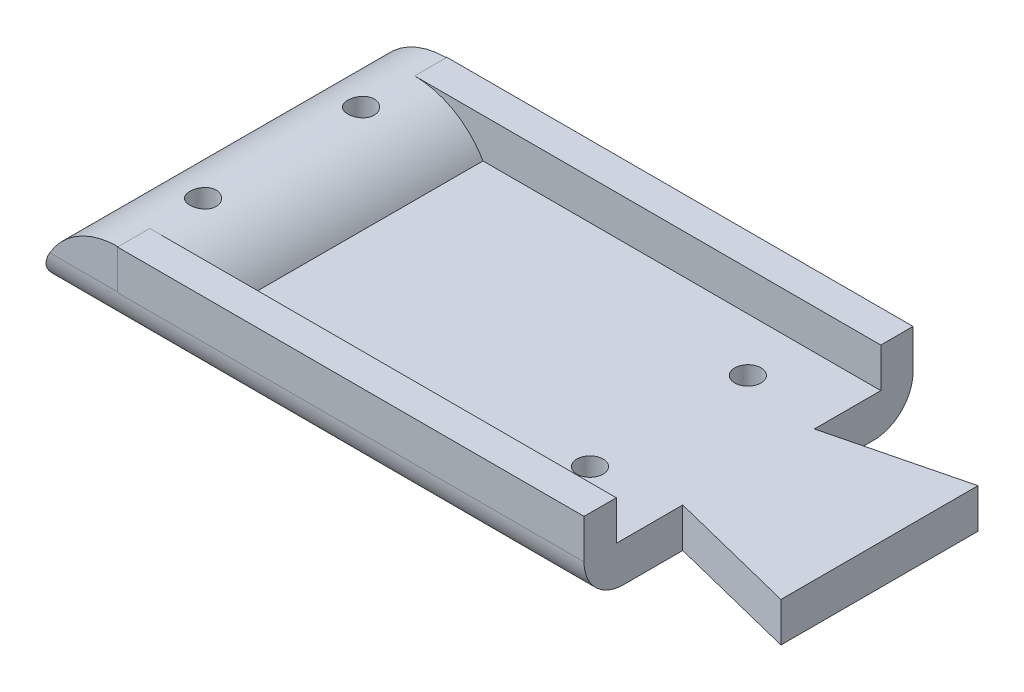
from build123d import *

# Parameters (mm, degrees)
CROQUIS1_R              = 0.999999899
CROQUIS1_R_2            = 0.999998866
CROQUIS1_R_3            = 1.000000014
CROQUIS1_R_4            = 0.999999985
SALIENTE_EXTRUIR1_DEPTH = 3
SALIENTE_EXTRUIR2_REACH = 38.281
CROQUIS3_W              = 35.45
CROQUIS3_H              = 2.45
SALIENTE_EXTRUIR3_DEPTH = 3
CROQUIS4_R              = 0.999999985
CROQUIS4_R_2            = 1.000000014
CORTAR_EXTRUIR1_DEPTH   = 17
CORTAR_EXTRUIR2_DEPTH   = 31
REDONDEO1_R             = 3


with BuildPart() as part:
    # Croquis1 → Saliente-Extruir1 (new body)
    with BuildSketch(Plane(origin=(0, 0, 0), x_dir=(1, 0, 0), z_dir=(0, 1, 0))):
        Polygon((25.246177886, -7.147133033), (25.246177886, 7.827867349), (15.296177123, 5.340367158), (15.296177123, 12.840367158), (-26.15382364, 12.790366967), (-26.15382364, -12.109632651), (15.296177123, -12.159632842), (15.296177123, -4.659632842), align=None)
        with Locations(Location((9.246177066, 6.34036702, 0), (0, 0, 270))):
            Circle(CROQUIS1_R, mode=Mode.SUBTRACT)
        with Locations(Location((9.246182607, -5.65963638, 0), (0, 0, 270))):
            Circle(CROQUIS1_R_2, mode=Mode.SUBTRACT)
        with Locations(Location((-20.153822905, -5.659632902, 0), (0, 0, 270))):
            Circle(CROQUIS1_R_3, mode=Mode.SUBTRACT)
        with Locations(Location((-20.15382331, 6.340367521, 0), (0, 0, 270))):
            Circle(CROQUIS1_R_4, mode=Mode.SUBTRACT)
    extrude(amount=SALIENTE_EXTRUIR1_DEPTH)

    # Saliente-Extruir2: up to this plane
    saliente_extruir2_end = Plane(origin=(15.296177123, 3, -12.840367158), z_dir=(0.0012062763193973866, 0, 0.999999272448456))
    # Croquis2 → Saliente-Extruir2 (add, up to the surface)
    with BuildSketch(Plane(origin=(-0.014645609, 0, 12.141163746), x_dir=(0.999999272448456, 0, 0.0012062763194219445), z_dir=(-0.0012062763194219447, 0, 0.999999272448456)), mode=Mode.PRIVATE) as saliente_extruir2_sk1:
        with BuildLine():
            Line((-25.335349472, 3), (-14.943044626, 3))
            ThreePointArc((-14.943044626, 3), (-20.139197049, 6), (-25.335349472, 3))
        make_face()
    saliente_extruir2_tool1 = split(extrude(saliente_extruir2_sk1.sketch, amount=-SALIENTE_EXTRUIR2_REACH, mode=Mode.PRIVATE), bisect_by=saliente_extruir2_end, keep=Keep.BOTH, mode=Mode.PRIVATE)
    add(saliente_extruir2_tool1.solids().sort_by_distance((-20.153828, 4.230121, 12.11687))[0])

    # Croquis3 → Saliente-Extruir3 (add)
    with BuildSketch(Plane(origin=(0, 3, 0), x_dir=(1, 0, 0), z_dir=(0, 1, 0))):
        with Locations((-2.428822877, -10.934632842)):
            Rectangle(CROQUIS3_W, CROQUIS3_H)
        with Locations((-2.428822877, 11.615367158)):
            Rectangle(CROQUIS3_W, CROQUIS3_H)
    extrude(amount=SALIENTE_EXTRUIR3_DEPTH)

    # Croquis4 → Cortar-Extruir1 (cut)
    with BuildSketch(Plane.XZ):
        with Locations(Location((-20.15382331, -6.340367521, 0), (0, 0, 270))):
            Circle(CROQUIS4_R)
        with Locations(Location((-20.153822905, 5.659632902, 0), (0, 0, 270))):
            Circle(CROQUIS4_R_2)
    extrude(amount=-CORTAR_EXTRUIR1_DEPTH, mode=Mode.SUBTRACT)

    # Croquis5 → Cortar-Extruir2 (cut)
    with BuildSketch(Plane(origin=(-0.014645609, 0, 12.141163746), x_dir=(0.999999272448456, 0, 0.0012062763194219445), z_dir=(-0.0012062763194219447, 0, 0.999999272448456))):
        with BuildLine():
            Line((-20.139197049, 6), (-20.139197049, 8.549534658))
            ThreePointArc((-20.139197049, 8.549534658), (-26.184630981, 6.045433933), (-28.688731707, 0))
            Line((-28.688731707, 0), (-26.139197049, 0))
            ThreePointArc((-26.139197049, 0), (-24.381837736, 4.242640687), (-20.139197049, 6))
        make_face()
    extrude(amount=-CORTAR_EXTRUIR2_DEPTH, mode=Mode.SUBTRACT)

    # Redondeo1
    redondeo1_edges = [part.edges().sort_by_distance(p)[0] for p in [
        (-5.428823259, 0, 12.134632747),
        (-5.413805086, 0, -12.815385179),
    ]]
    fillet(redondeo1_edges, radius=REDONDEO1_R - 0.0001)  # a hair under: the kernel refuses the full size


solid = part.part
